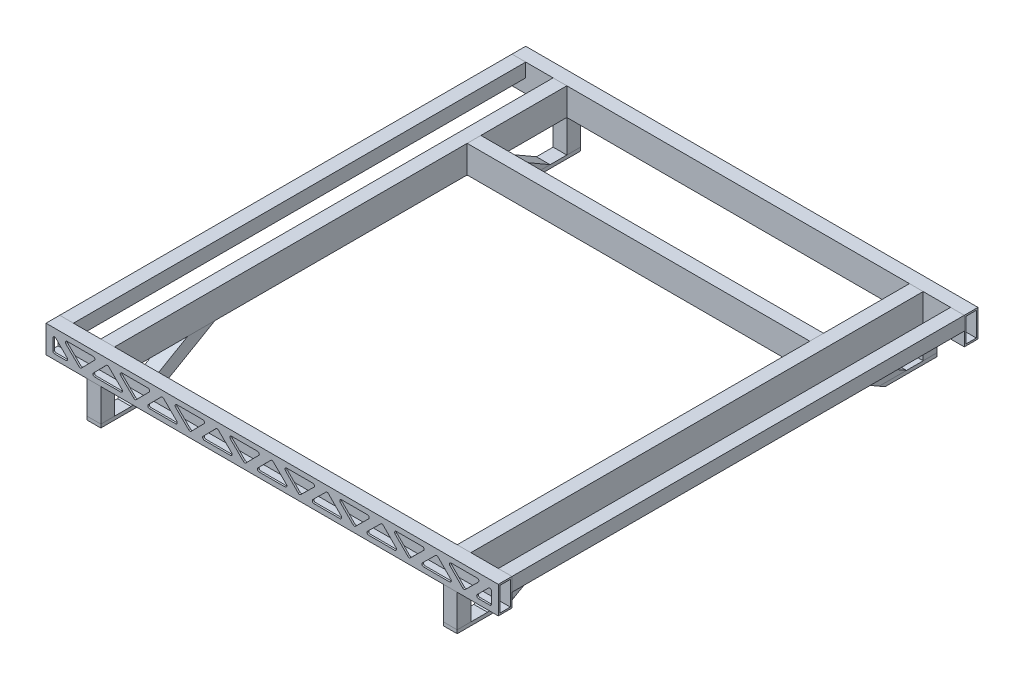
from build123d import *

# Parameters (mm, degrees)
SKETCH12_W                                = 50.8
SKETCH12_H                                = 25.4
SKETCH12_W_2                              = 44.45
SKETCH12_H_2                              = 19.05
RECTANGULAR_TUBE_2_X_1_X_0_125_1_DEPTH    = 812.8
SKETCH12_ON_SEGMENT_2_W                   = 50.8
SKETCH12_ON_SEGMENT_2_H                   = 25.4
SKETCH12_ON_SEGMENT_2_W_2                 = 44.45
SKETCH12_ON_SEGMENT_2_H_2                 = 19.05
RECTANGULAR_TUBE_2_X_1_X_0_125_1_2_DEPTH  = 812.8
SKETCH12_ON_SEGMENT_3_W                   = 50.8
SKETCH12_ON_SEGMENT_3_H                   = 25.4
SKETCH12_ON_SEGMENT_3_W_2                 = 44.45
SKETCH12_ON_SEGMENT_3_H_2                 = 19.05
RECTANGULAR_TUBE_2_X_1_X_0_125_1_3_DEPTH  = 865.6
SKETCH12_ON_SEGMENT_4_W                   = 50.8
SKETCH12_ON_SEGMENT_4_H                   = 25.4
SKETCH12_ON_SEGMENT_4_W_2                 = 44.45
SKETCH12_ON_SEGMENT_4_H_2                 = 19.05
RECTANGULAR_TUBE_2_X_1_X_0_125_1_4_DEPTH  = 865.6
SKETCH15_W                                = 25.4
SKETCH15_H                                = 25.4
SKETCH15_W_2                              = 19.05
SKETCH15_H_2                              = 19.05
RECTANGULAR_TUBE_1_X_1_X_0_125_2_DEPTH    = 863.6
PART_RUN_ON_DEPTH                         = 12.7
BODY_2_RUN_ON_DEPTH                       = 12.7
SKETCH16_W                                = 25.4
SKETCH16_H                                = 25.4
SKETCH16_W_2                              = 19.05
SKETCH16_H_2                              = 19.05
RECTANGULAR_TUBE_1_X_1_X_0_125_3_DEPTH    = 863.6
BODY_START                                = 812.8
BODY_2_RUN_ON_2_DEPTH                     = 12.7
PART_START                                = 812.8
PART_RUN_ON_2_DEPTH                       = 12.7
SKETCH17_W                                = 25.4
SKETCH17_H                                = 25.4
SKETCH17_W_2                              = 19.05
SKETCH17_H_2                              = 19.05
RECTANGULAR_TUBE_1_X_1_X_0_125_4_DEPTH    = 88.9
SKETCH18_W                                = 25.4
SKETCH18_H                                = 25.4
SKETCH18_W_2                              = 19.05
SKETCH18_H_2                              = 19.05
RECTANGULAR_TUBE_1_X_1_X_0_125_5_DEPTH    = 177.8
SKETCH110_W                               = 25.4
SKETCH110_H                               = 6.35
FLAT_STOCK_1_X_0_25_1_DEPTH               = 63.5
BODY_9_RUN_ON_DEPTH                       = 12.7
BODY_START_2                              = 63.5
BODY_9_RUN_ON_2_DEPTH                     = 135.385226
BODY_START_3                              = -1e-09
BODY_8_RUN_ON_DEPTH                       = 95.320529
SKETCH111_W                               = 25.4
SKETCH111_H                               = 25.4
SKETCH111_W_2                             = 19.05
SKETCH111_H_2                             = 19.05
RECTANGULAR_TUBE_1_X_1_X_0_125_14_DEPTH   = 88.9
SKETCH111_ON_SEGMENT_2_W                  = 25.4
SKETCH111_ON_SEGMENT_2_H                  = 25.4
SKETCH111_ON_SEGMENT_2_W_2                = 19.05
SKETCH111_ON_SEGMENT_2_H_2                = 19.05
RECTANGULAR_TUBE_1_X_1_X_0_125_14_2_DEPTH = 88.9
SKETCH111_ON_SEGMENT_3_W                  = 25.4
SKETCH111_ON_SEGMENT_3_H                  = 25.4
SKETCH111_ON_SEGMENT_3_W_2                = 19.05
SKETCH111_ON_SEGMENT_3_H_2                = 19.05
RECTANGULAR_TUBE_1_X_1_X_0_125_14_3_DEPTH = 88.9
SKETCH112_W                               = 25.4
SKETCH112_H                               = 25.4
SKETCH112_W_2                             = 19.05
SKETCH112_H_2                             = 19.05
RECTANGULAR_TUBE_1_X_1_X_0_125_15_DEPTH   = 177.8
SKETCH113_W                               = 25.4
SKETCH113_H                               = 25.4
SKETCH113_W_2                             = 19.05
SKETCH113_H_2                             = 19.05
RECTANGULAR_TUBE_1_X_1_X_0_125_16_DEPTH   = 177.8
SKETCH114_W                               = 25.4
SKETCH114_H                               = 25.4
SKETCH114_W_2                             = 19.05
SKETCH114_H_2                             = 19.05
RECTANGULAR_TUBE_1_X_1_X_0_125_17_DEPTH   = 177.8
SKETCH115_W                               = 25.4
SKETCH115_H                               = 6.35
FLAT_STOCK_1_X_0_25_2_DEPTH               = 63.5
SKETCH115_ON_SEGMENT_2_W                  = 25.4
SKETCH115_ON_SEGMENT_2_H                  = 6.35
FLAT_STOCK_1_X_0_25_2_2_DEPTH             = 63.5
SKETCH115_ON_SEGMENT_3_W                  = 25.4
SKETCH115_ON_SEGMENT_3_H                  = 6.35
FLAT_STOCK_1_X_0_25_2_3_DEPTH             = 63.5
BODY_17_RUN_ON_DEPTH                      = 207.138843
BODY_14_RUN_ON_DEPTH                      = 80.655833
BODY_17_RUN_ON_2_DEPTH                    = 12.7
BODY_16_RUN_ON_DEPTH                      = 12.7
BODY_16_RUN_ON_2_DEPTH                    = 207.138843
BODY_13_RUN_ON_DEPTH                      = 95.320529
BODY_18_RUN_ON_DEPTH                      = 207.138843
BODY_15_RUN_ON_DEPTH                      = 80.655833
BODY_18_RUN_ON_2_DEPTH                    = 12.7
TRIM_EXTEND18_START                       = -25.4
TRIM_EXTEND18_OUTLINE_W                   = 25.4
TRIM_EXTEND18_OUTLINE_H                   = 79
TRIM_EXTEND18_DEPTH                       = 36.398522628
SKETCH1_W                                 = 50.8
SKETCH1_H                                 = 25.4
SKETCH1_W_2                               = 44.45
SKETCH1_H_2                               = 19.05
RECTANGULAR_TUBE_2_X_1_X_0_125_4_DEPTH    = 660.4
CUT_EXTRUDE1_DEPTH                        = 3.175


# Read off the part's stored shape, not the designer's step: Trim/Extend18
with BuildPart() as part:
    # Sketch12 → Rectangular tube 2 X 1 X 0.125(1) (new body)
    with BuildSketch(Plane(origin=(-406.4, 0, -431.8), x_dir=(0, 1, 0), z_dir=(1, 0, 0))):
        Rectangle(SKETCH12_W, SKETCH12_H)
        Rectangle(SKETCH12_W_2, SKETCH12_H_2, mode=Mode.SUBTRACT)
    extrude(amount=RECTANGULAR_TUBE_2_X_1_X_0_125_1_DEPTH)

    # Sketch12 → part run on (add)
    with BuildSketch(Plane(origin=(-406.4, 0, -431.8), x_dir=(0, 1, 0), z_dir=(1, 0, 0))):
        Rectangle(SKETCH12_W, SKETCH12_H)
        Rectangle(SKETCH12_W_2, SKETCH12_H_2, mode=Mode.SUBTRACT)
    extrude(amount=-PART_RUN_ON_DEPTH)

    # Sketch12 → part run on 2 (add)
    with BuildSketch(Plane(origin=(-406.4, 0, -431.8), x_dir=(0, 1, 0), z_dir=(1, 0, 0)).offset(PART_START)):
        Rectangle(SKETCH12_W, SKETCH12_H)
        Rectangle(SKETCH12_W_2, SKETCH12_H_2, mode=Mode.SUBTRACT)
    extrude(amount=PART_RUN_ON_2_DEPTH)


with BuildPart() as body_2:
    # Sketch12 on segment 2 (carried to segment 2) → Rectangular tube 2 X 1 X 0.125_1 2 (new body)
    with BuildSketch(Plane(origin=(-406.4, 0, 431.8), x_dir=(0, 1, 0), z_dir=(1, 0, 0))):
        Rectangle(SKETCH12_ON_SEGMENT_2_W, SKETCH12_ON_SEGMENT_2_H)
        Rectangle(SKETCH12_ON_SEGMENT_2_W_2, SKETCH12_ON_SEGMENT_2_H_2, mode=Mode.SUBTRACT)
    extrude(amount=RECTANGULAR_TUBE_2_X_1_X_0_125_1_2_DEPTH)

    # Sketch12 on segment 2 (carried to segment 2) → body 2 run on (add)
    with BuildSketch(Plane(origin=(-406.4, 0, 431.8), x_dir=(0, 1, 0), z_dir=(1, 0, 0))):
        Rectangle(SKETCH12_ON_SEGMENT_2_W, SKETCH12_ON_SEGMENT_2_H)
        Rectangle(SKETCH12_ON_SEGMENT_2_W_2, SKETCH12_ON_SEGMENT_2_H_2, mode=Mode.SUBTRACT)
    extrude(amount=-BODY_2_RUN_ON_DEPTH)

    # Sketch12 on segment 2 (carried to segment 2) → body 2 run on 2 (add)
    with BuildSketch(Plane(origin=(-406.4, 0, 431.8), x_dir=(0, 1, 0), z_dir=(1, 0, 0)).offset(BODY_START)):
        Rectangle(SKETCH12_ON_SEGMENT_2_W, SKETCH12_ON_SEGMENT_2_H)
        Rectangle(SKETCH12_ON_SEGMENT_2_W_2, SKETCH12_ON_SEGMENT_2_H_2, mode=Mode.SUBTRACT)
    extrude(amount=BODY_2_RUN_ON_2_DEPTH)

    # Sketch116 → Cut-Extrude1 (cut)
    with BuildSketch(Plane.XY.offset(444.5)):
        with BuildLine():
            Line((-406.4, 8.209871939), (-406.4, -12.7))
            ThreePointArc((-406.4, -12.7), (-405.47006403, -14.94506403), (-403.225, -15.875))
            Line((-403.225, -15.875), (-382.315128061, -15.875))
            ThreePointArc((-382.315128061, -15.875), (-379.381810545, -13.915019898), (-380.07006403, -10.45493597))
            Line((-380.07006403, -10.45493597), (-400.97993597, 10.45493597))
            ThreePointArc((-400.97993597, 10.45493597), (-404.440019898, 11.143189455), (-406.4, 8.209871939))
        make_face()
        with BuildLine():
            Line((403.225, -15.875), (382.315128061, -15.875))
            ThreePointArc((382.315128061, -15.875), (379.381810545, -13.915019898), (380.07006403, -10.45493597))
            Line((380.07006403, -10.45493597), (400.97993597, 10.45493597))
            ThreePointArc((400.97993597, 10.45493597), (404.440019898, 11.143189455), (406.4, 8.209871939))
            Line((406.4, 8.209871939), (406.4, -12.7))
            ThreePointArc((406.4, -12.7), (405.47006403, -14.94506403), (403.225, -15.875))
        make_face()
        with BuildLine():
            Line((-331.123393313, -10.470866156), (-307.376619293, 13.614118024))
            ThreePointArc((-307.376619293, 13.614118024), (-305.138186637, 14.559904814), (-302.886603474, 13.645866156))
            Line((-302.886603474, 13.645866156), (-278.458592221, -10.439118024))
            ThreePointArc((-278.458592221, -10.439118024), (-277.750131362, -13.904642006), (-280.687726064, -15.875))
            Line((-280.687726064, -15.875), (-328.862511338, -15.875))
            ThreePointArc((-328.862511338, -15.875), (-331.791515004, -13.925382603), (-331.123393313, -10.470866156))
        make_face()
        with BuildLine():
            Line((-329.518410641, 10.470866156), (-353.265184661, -13.614118024))
            ThreePointArc((-353.265184661, -13.614118024), (-355.503617317, -14.559904814), (-357.75520048, -13.645866156))
            Line((-357.75520048, -13.645866156), (-382.183211734, 10.439118024))
            ThreePointArc((-382.183211734, 10.439118024), (-382.891672593, 13.904642006), (-379.95407789, 15.875))
            Line((-379.95407789, 15.875), (-331.779292617, 15.875))
            ThreePointArc((-331.779292617, 15.875), (-328.850288951, 13.925382603), (-329.518410641, 10.470866156))
        make_face()
        with BuildLine():
            Line((-227.926704408, 10.470866156), (-251.673478428, -13.614118024))
            ThreePointArc((-251.673478428, -13.614118024), (-253.911911084, -14.559904814), (-256.163494247, -13.645866156))
            Line((-256.163494247, -13.645866156), (-280.5915055, 10.439118024))
            ThreePointArc((-280.5915055, 10.439118024), (-281.299966359, 13.904642006), (-278.362371657, 15.875))
            Line((-278.362371657, 15.875), (-230.187586383, 15.875))
            ThreePointArc((-230.187586383, 15.875), (-227.258582717, 13.925382603), (-227.926704408, 10.470866156))
        make_face()
        with BuildLine():
            Line((-126.334998174, 10.470866156), (-150.081772194, -13.614118024))
            ThreePointArc((-150.081772194, -13.614118024), (-152.32020485, -14.559904814), (-154.571788013, -13.645866156))
            Line((-154.571788013, -13.645866156), (-178.999799267, 10.439118024))
            ThreePointArc((-178.999799267, 10.439118024), (-179.708260125, 13.904642006), (-176.770665423, 15.875))
            Line((-176.770665423, 15.875), (-128.59588015, 15.875))
            ThreePointArc((-128.59588015, 15.875), (-125.666876483, 13.925382603), (-126.334998174, 10.470866156))
        make_face()
        with BuildLine():
            Line((-24.74329194, 10.470866156), (-48.49006596, -13.614118024))
            ThreePointArc((-48.49006596, -13.614118024), (-50.728498616, -14.559904814), (-52.980081779, -13.645866156))
            Line((-52.980081779, -13.645866156), (-77.408093033, 10.439118024))
            ThreePointArc((-77.408093033, 10.439118024), (-78.116553892, 13.904642006), (-75.178959189, 15.875))
            Line((-75.178959189, 15.875), (-27.004173916, 15.875))
            ThreePointArc((-27.004173916, 15.875), (-24.07517025, 13.925382603), (-24.74329194, 10.470866156))
        make_face()
        with BuildLine():
            Line((-229.53168708, -10.470866156), (-205.78491306, 13.614118024))
            ThreePointArc((-205.78491306, 13.614118024), (-203.546480403, 14.559904814), (-201.29489724, 13.645866156))
            Line((-201.29489724, 13.645866156), (-176.866885987, -10.439118024))
            ThreePointArc((-176.866885987, -10.439118024), (-176.158425128, -13.904642006), (-179.096019831, -15.875))
            Line((-179.096019831, -15.875), (-227.270805104, -15.875))
            ThreePointArc((-227.270805104, -15.875), (-230.19980877, -13.925382603), (-229.53168708, -10.470866156))
        make_face()
        with BuildLine():
            Line((-127.939980846, -10.470866156), (-104.193206826, 13.614118024))
            ThreePointArc((-104.193206826, 13.614118024), (-101.95477417, 14.559904814), (-99.703191007, 13.645866156))
            Line((-99.703191007, 13.645866156), (-75.275179753, -10.439118024))
            ThreePointArc((-75.275179753, -10.439118024), (-74.566718894, -13.904642006), (-77.504313597, -15.875))
            Line((-77.504313597, -15.875), (-125.67909887, -15.875))
            ThreePointArc((-125.67909887, -15.875), (-128.608102537, -13.925382603), (-127.939980846, -10.470866156))
        make_face()
        with BuildLine():
            Line((-26.348274612, -10.470866156), (-2.601500592, 13.614118024))
            ThreePointArc((-2.601500592, 13.614118024), (-0.363067936, 14.559904814), (1.888515227, 13.645866156))
            Line((1.888515227, 13.645866156), (26.31652648, -10.439118024))
            ThreePointArc((26.31652648, -10.439118024), (27.024987339, -13.904642006), (24.087392637, -15.875))
            Line((24.087392637, -15.875), (-24.087392637, -15.875))
            ThreePointArc((-24.087392637, -15.875), (-27.016396303, -13.925382603), (-26.348274612, -10.470866156))
        make_face()
        with BuildLine():
            Line((229.53168708, -10.470866156), (205.78491306, 13.614118024))
            ThreePointArc((205.78491306, 13.614118024), (203.546480403, 14.559904814), (201.29489724, 13.645866156))
            Line((201.29489724, 13.645866156), (176.866885987, -10.439118024))
            ThreePointArc((176.866885987, -10.439118024), (176.158425128, -13.904642006), (179.096019831, -15.875))
            Line((179.096019831, -15.875), (227.270805104, -15.875))
            ThreePointArc((227.270805104, -15.875), (230.19980877, -13.925382603), (229.53168708, -10.470866156))
        make_face()
        with BuildLine():
            Line((127.939980846, -10.470866156), (104.193206826, 13.614118024))
            ThreePointArc((104.193206826, 13.614118024), (101.95477417, 14.559904814), (99.703191007, 13.645866156))
            Line((99.703191007, 13.645866156), (75.275179753, -10.439118024))
            ThreePointArc((75.275179753, -10.439118024), (74.566718894, -13.904642006), (77.504313597, -15.875))
            Line((77.504313597, -15.875), (125.67909887, -15.875))
            ThreePointArc((125.67909887, -15.875), (128.608102537, -13.925382603), (127.939980846, -10.470866156))
        make_face()
        with BuildLine():
            Line((227.926704408, 10.470866156), (251.673478428, -13.614118024))
            ThreePointArc((251.673478428, -13.614118024), (253.911911084, -14.559904814), (256.163494247, -13.645866156))
            Line((256.163494247, -13.645866156), (280.5915055, 10.439118024))
            ThreePointArc((280.5915055, 10.439118024), (281.299966359, 13.904642006), (278.362371657, 15.875))
            Line((278.362371657, 15.875), (230.187586383, 15.875))
            ThreePointArc((230.187586383, 15.875), (227.258582717, 13.925382603), (227.926704408, 10.470866156))
        make_face()
        with BuildLine():
            Line((126.334998174, 10.470866156), (150.081772194, -13.614118024))
            ThreePointArc((150.081772194, -13.614118024), (152.32020485, -14.559904814), (154.571788013, -13.645866156))
            Line((154.571788013, -13.645866156), (178.999799267, 10.439118024))
            ThreePointArc((178.999799267, 10.439118024), (179.708260125, 13.904642006), (176.770665423, 15.875))
            Line((176.770665423, 15.875), (128.59588015, 15.875))
            ThreePointArc((128.59588015, 15.875), (125.666876483, 13.925382603), (126.334998174, 10.470866156))
        make_face()
        with BuildLine():
            Line((24.74329194, 10.470866156), (48.49006596, -13.614118024))
            ThreePointArc((48.49006596, -13.614118024), (50.728498616, -14.559904814), (52.980081779, -13.645866156))
            Line((52.980081779, -13.645866156), (77.408093033, 10.439118024))
            ThreePointArc((77.408093033, 10.439118024), (78.116553892, 13.904642006), (75.178959189, 15.875))
            Line((75.178959189, 15.875), (27.004173916, 15.875))
            ThreePointArc((27.004173916, 15.875), (24.07517025, 13.925382603), (24.74329194, 10.470866156))
        make_face()
        with BuildLine():
            Line((329.518410641, 10.470866156), (353.265184661, -13.614118024))
            ThreePointArc((353.265184661, -13.614118024), (355.503617317, -14.559904814), (357.75520048, -13.645866156))
            Line((357.75520048, -13.645866156), (382.183211734, 10.439118024))
            ThreePointArc((382.183211734, 10.439118024), (382.891672593, 13.904642006), (379.95407789, 15.875))
            Line((379.95407789, 15.875), (331.779292617, 15.875))
            ThreePointArc((331.779292617, 15.875), (328.850288951, 13.925382603), (329.518410641, 10.470866156))
        make_face()
        with BuildLine():
            Line((331.123393313, -10.470866156), (307.376619293, 13.614118024))
            ThreePointArc((307.376619293, 13.614118024), (305.138186637, 14.559904814), (302.886603474, 13.645866156))
            Line((302.886603474, 13.645866156), (278.458592221, -10.439118024))
            ThreePointArc((278.458592221, -10.439118024), (277.750131362, -13.904642006), (280.687726064, -15.875))
            Line((280.687726064, -15.875), (328.862511338, -15.875))
            ThreePointArc((328.862511338, -15.875), (331.791515004, -13.925382603), (331.123393313, -10.470866156))
        make_face()
    extrude(amount=-CUT_EXTRUDE1_DEPTH, mode=Mode.SUBTRACT)


with BuildPart() as body_3:
    # Sketch12 on segment 3 (carried to segment 3) → Rectangular tube 2 X 1 X 0.125_1 3 (new body)
    with BuildSketch(Plane(origin=(-330.2, 0, -432.8), x_dir=(0, 1, 0), z_dir=(0, 0, 1))):
        Rectangle(SKETCH12_ON_SEGMENT_3_W, SKETCH12_ON_SEGMENT_3_H)
        Rectangle(SKETCH12_ON_SEGMENT_3_W_2, SKETCH12_ON_SEGMENT_3_H_2, mode=Mode.SUBTRACT)
    extrude(amount=RECTANGULAR_TUBE_2_X_1_X_0_125_1_3_DEPTH)

    # Rectangular tube 2 X 1 X 0.125_1 3 end b
    split(bisect_by=Plane(origin=(-330.2, 0, -419.1), x_dir=(0, -1, 0), z_dir=(0, 0, 1)), keep=Keep.TOP)

    # Rectangular tube 2 X 1 X 0.125_1 3 e 2
    split(bisect_by=Plane(origin=(-330.2, 0, 419.1), x_dir=(0, 1, 0), z_dir=(0, 0, -1)), keep=Keep.TOP)


with BuildPart() as body_4:
    # Sketch12 on segment 4 (carried to segment 4) → Rectangular tube 2 X 1 X 0.125_1 4 (new body)
    with BuildSketch(Plane(origin=(330.2, 0, -432.8), x_dir=(0, 1, 0), z_dir=(0, 0, 1))):
        Rectangle(SKETCH12_ON_SEGMENT_4_W, SKETCH12_ON_SEGMENT_4_H)
        Rectangle(SKETCH12_ON_SEGMENT_4_W_2, SKETCH12_ON_SEGMENT_4_H_2, mode=Mode.SUBTRACT)
    extrude(amount=RECTANGULAR_TUBE_2_X_1_X_0_125_1_4_DEPTH)

    # Rectangular tube 2 X 1 X 0.125_1 4 end b
    split(bisect_by=Plane(origin=(330.2, 0, -419.1), x_dir=(0, -1, 0), z_dir=(0, 0, 1)), keep=Keep.TOP)

    # Rectangular tube 2 X 1 X 0.125_1 4 e 2
    split(bisect_by=Plane(origin=(330.2, 0, 419.1), x_dir=(0, 1, 0), z_dir=(0, 0, -1)), keep=Keep.TOP)


with BuildPart() as body_5:
    # Sketch15 → Rectangular tube 1 X 1 X 0.125(2) (new body)
    with BuildSketch(Plane(origin=(-406.4, 12.7, -431.8), x_dir=(1, 0, 0), z_dir=(0, 0, 1))):
        Rectangle(SKETCH15_W, SKETCH15_H)
        Rectangle(SKETCH15_W_2, SKETCH15_H_2, mode=Mode.SUBTRACT)
    extrude(amount=RECTANGULAR_TUBE_1_X_1_X_0_125_2_DEPTH)

    # Trim_Extend4 3
    split(bisect_by=Plane(origin=(0, 0, -419.1), x_dir=(0, -1, 0), z_dir=(0, 0, 1)), keep=Keep.TOP)

    # Trim/Extend5
    split(bisect_by=Plane.YX.offset(-419.1), keep=Keep.TOP)


with BuildPart() as body_6:
    # Sketch16 → Rectangular tube 1 X 1 X 0.125(3) (new body)
    with BuildSketch(Plane(origin=(406.4, 12.7, -431.8), x_dir=(1, 0, 0), z_dir=(0, 0, 1))):
        Rectangle(SKETCH16_W, SKETCH16_H)
        Rectangle(SKETCH16_W_2, SKETCH16_H_2, mode=Mode.SUBTRACT)
    extrude(amount=RECTANGULAR_TUBE_1_X_1_X_0_125_3_DEPTH)

    # Trim/Extend6
    split(bisect_by=Plane(origin=(-6.35, 0, 419.1), x_dir=(0, 1, 0), z_dir=(0, 0, -1)), keep=Keep.TOP)

    # Trim_Extend7 3
    split(bisect_by=Plane(origin=(-6.35, 0, -419.1), x_dir=(0, -1, 0), z_dir=(0, 0, 1)), keep=Keep.TOP)


with BuildPart() as body_7:
    # Sketch17 → Rectangular tube 1 X 1 X 0.125(4) (new body)
    with BuildSketch(Plane(origin=(330.2, 0, 431.8), x_dir=(1, 0, 0), z_dir=(0, -1, 0))):
        Rectangle(SKETCH17_W, SKETCH17_H)
        Rectangle(SKETCH17_W_2, SKETCH17_H_2, mode=Mode.SUBTRACT)
    extrude(amount=RECTANGULAR_TUBE_1_X_1_X_0_125_4_DEPTH)

    # Trim_Extend8 11
    split(bisect_by=Plane(origin=(0, -25.4, 431.8), x_dir=(1, 0, 0), z_dir=(0, -1, 0)), keep=Keep.TOP)

    # Trim/Extend10
    split(bisect_by=Plane(origin=(330.2, -85.725, 400.05), x_dir=(-1, 0, 0), z_dir=(0, 1, 0)), keep=Keep.TOP)


with BuildPart() as body_8:
    # Sketch18 → Rectangular tube 1 X 1 X 0.125(5) (new body)
    with BuildSketch(Plane(origin=(330.2, -88.9, 368.3), x_dir=(1, 0, 0), z_dir=(0, 0.49999999999999534, -0.8660254037844414))):
        Rectangle(SKETCH18_W, SKETCH18_H)
        Rectangle(SKETCH18_W_2, SKETCH18_H_2, mode=Mode.SUBTRACT)
    extrude(amount=RECTANGULAR_TUBE_1_X_1_X_0_125_5_DEPTH)

    # Trim/Extend9
    split(bisect_by=Plane(origin=(330.2, -25.4, 0), x_dir=(1, 0, 0), z_dir=(0, -1, 0)), keep=Keep.TOP)

    # Sketch18 → body 8 run on (add)
    with BuildSketch(Plane(origin=(330.2, -88.9, 368.3), x_dir=(1, 0, 0), z_dir=(0, 0.49999999999999534, -0.8660254037844414)).offset(BODY_START_3)):
        Rectangle(SKETCH18_W, SKETCH18_H)
        Rectangle(SKETCH18_W_2, SKETCH18_H_2, mode=Mode.SUBTRACT)
    extrude(amount=-BODY_8_RUN_ON_DEPTH)

    # Trim/Extend11
    split(bisect_by=Plane(origin=(330.2, -85.725, 406.4), x_dir=(-1, 0, 0), z_dir=(0, 1, 0)), keep=Keep.TOP)


with BuildPart() as body_9:
    # Sketch110 → Flat stock 1 X 0.25(1) (new body)
    with BuildSketch(Plane(origin=(330.2, -88.9, 431.8), x_dir=(1, 0, 0), z_dir=(0, 0, -1))):
        Rectangle(SKETCH110_W, SKETCH110_H)
    extrude(amount=FLAT_STOCK_1_X_0_25_1_DEPTH)

    # Sketch110 → body 9 run on (add)
    with BuildSketch(Plane(origin=(330.2, -88.9, 431.8), x_dir=(1, 0, 0), z_dir=(0, 0, -1))):
        Rectangle(SKETCH110_W, SKETCH110_H)
    extrude(amount=-BODY_9_RUN_ON_DEPTH)

    # Sketch110 → body 9 run on 2 (add)
    with BuildSketch(Plane(origin=(330.2, -88.9, 431.8), x_dir=(1, 0, 0), z_dir=(0, 0, -1)).offset(BODY_START_2)):
        Rectangle(SKETCH110_W, SKETCH110_H)
    extrude(amount=BODY_9_RUN_ON_2_DEPTH)

    # Trim_Extend11 2
    split(bisect_by=Plane(origin=(330.2, -62.649261314, 297.43238686), x_dir=(-1, 0, 0), z_dir=(0, 0.866025404, 0.5)), keep=Keep.TOP)


with BuildPart() as body_10:
    # Sketch111 → Rectangular tube 1 X 1 X 0.125(14) (new body)
    with BuildSketch(Plane(origin=(-330.2, 0, 431.8), x_dir=(1, 0, 0), z_dir=(0, -1, 0))):
        Rectangle(SKETCH111_W, SKETCH111_H)
        Rectangle(SKETCH111_W_2, SKETCH111_H_2, mode=Mode.SUBTRACT)
    extrude(amount=RECTANGULAR_TUBE_1_X_1_X_0_125_14_DEPTH)

    # Trim/Extend14
    split(bisect_by=Plane(origin=(-330.2, -85.725, 400.05), x_dir=(-1, 0, 0), z_dir=(0, 1, 0)), keep=Keep.TOP)

    # Trim/Extend22
    split(bisect_by=Plane(origin=(0, -25.4, 431.8), x_dir=(1, 0, 0), z_dir=(0, -1, 0)), keep=Keep.TOP)


with BuildPart() as body_11:
    # Sketch111 on segment 2 (carried to segment 2) → Rectangular tube 1 X 1 X 0.125_14 2 (new body)
    with BuildSketch(Plane(origin=(-330.2, 0, -431.8), x_dir=(1, 0, 0), z_dir=(0, -1, 0))):
        Rectangle(SKETCH111_ON_SEGMENT_2_W, SKETCH111_ON_SEGMENT_2_H)
        Rectangle(SKETCH111_ON_SEGMENT_2_W_2, SKETCH111_ON_SEGMENT_2_H_2, mode=Mode.SUBTRACT)
    extrude(amount=RECTANGULAR_TUBE_1_X_1_X_0_125_14_2_DEPTH)

    # Trim/Extend17
    split(bisect_by=Plane(origin=(-330.2, -85.725, -384.60036935), x_dir=(-1, 0, 0), z_dir=(0, 1, 0)), keep=Keep.TOP)

    # Trim/Extend20
    split(bisect_by=Plane(origin=(-330.2, -25.4, 0), x_dir=(1, 0, 0), z_dir=(0, -1, 0)), keep=Keep.TOP)


with BuildPart() as body_12:
    # Sketch111 on segment 3 (carried to segment 3) → Rectangular tube 1 X 1 X 0.125_14 3 (new body)
    with BuildSketch(Plane(origin=(330.2, 0, -431.8), x_dir=(1, 0, 0), z_dir=(0, -1, 0))):
        Rectangle(SKETCH111_ON_SEGMENT_3_W, SKETCH111_ON_SEGMENT_3_H)
        Rectangle(SKETCH111_ON_SEGMENT_3_W_2, SKETCH111_ON_SEGMENT_3_H_2, mode=Mode.SUBTRACT)
    extrude(amount=RECTANGULAR_TUBE_1_X_1_X_0_125_14_3_DEPTH)

    # Trim/Extend13
    split(bisect_by=Plane(origin=(330.2, -85.725, -384.60036935), x_dir=(-1, 0, 0), z_dir=(0, 1, 0)), keep=Keep.TOP)

    # Trim/Extend19
    split(bisect_by=Plane(origin=(0, -25.4, -431.8), x_dir=(1, 0, 0), z_dir=(0, -1, 0)), keep=Keep.TOP)


with BuildPart() as body_13:
    # Sketch112 → Rectangular tube 1 X 1 X 0.125(15) (new body)
    with BuildSketch(Plane(origin=(-330.2, -88.9, 368.3), x_dir=(1, 0, 0), z_dir=(0, 0.49999999999999534, -0.8660254037844414))):
        Rectangle(SKETCH112_W, SKETCH112_H)
        Rectangle(SKETCH112_W_2, SKETCH112_H_2, mode=Mode.SUBTRACT)
    extrude(amount=RECTANGULAR_TUBE_1_X_1_X_0_125_15_DEPTH)

    # Sketch112 → body 13 run on (add)
    with BuildSketch(Plane(origin=(-330.2, -88.9, 368.3), x_dir=(1, 0, 0), z_dir=(0, 0.49999999999999534, -0.8660254037844414)).offset(BODY_START_3)):
        Rectangle(SKETCH112_W, SKETCH112_H)
        Rectangle(SKETCH112_W_2, SKETCH112_H_2, mode=Mode.SUBTRACT)
    extrude(amount=-BODY_13_RUN_ON_DEPTH)

    # Trim/Extend15
    split(bisect_by=Plane(origin=(-330.2, -85.725, 406.4), x_dir=(-1, 0, 0), z_dir=(0, 1, 0)), keep=Keep.TOP)

    # Trim/Extend21
    split(bisect_by=Plane(origin=(-330.2, -25.4, 0), x_dir=(1, 0, 0), z_dir=(0, -1, 0)), keep=Keep.TOP)


with BuildPart() as body_14:
    # Sketch113 → Rectangular tube 1 X 1 X 0.125(16) (new body)
    with BuildSketch(Plane(origin=(330.2, -88.9, -368.3), x_dir=(1, 0, 0), z_dir=(0, 0.4999999999999952, 0.8660254037844414))):
        Rectangle(SKETCH113_W, SKETCH113_H)
        Rectangle(SKETCH113_W_2, SKETCH113_H_2, mode=Mode.SUBTRACT)
    extrude(amount=RECTANGULAR_TUBE_1_X_1_X_0_125_16_DEPTH)

    # Sketch113 → body 14 run on (add)
    with BuildSketch(Plane(origin=(330.2, -88.9, -368.3), x_dir=(1, 0, 0), z_dir=(0, 0.4999999999999952, 0.8660254037844414)).offset(BODY_START_3)):
        Rectangle(SKETCH113_W, SKETCH113_H)
        Rectangle(SKETCH113_W_2, SKETCH113_H_2, mode=Mode.SUBTRACT)
    extrude(amount=-BODY_14_RUN_ON_DEPTH)

    # Trim/Extend12
    split(bisect_by=Plane(origin=(330.2, -85.725, -400.05), x_dir=(-1, 0, 0), z_dir=(0, 1, 0)), keep=Keep.TOP)

    # Trim/Extend18 outline → Trim/Extend18 (cut)
    with BuildSketch(Plane(origin=(0, 0, 0), x_dir=(1, 0, 0), z_dir=(0, 1, 0)).offset(TRIM_EXTEND18_START)):
        with Locations((330.2, 245.5)):
            Rectangle(TRIM_EXTEND18_OUTLINE_W, TRIM_EXTEND18_OUTLINE_H)
    extrude(amount=TRIM_EXTEND18_DEPTH, mode=Mode.SUBTRACT)


with BuildPart() as body_15:
    # Sketch114 → Rectangular tube 1 X 1 X 0.125(17) (new body)
    with BuildSketch(Plane(origin=(-330.2, -88.9, -368.3), x_dir=(1, 0, 0), z_dir=(0, 0.4999999999999952, 0.8660254037844414))):
        Rectangle(SKETCH114_W, SKETCH114_H)
        Rectangle(SKETCH114_W_2, SKETCH114_H_2, mode=Mode.SUBTRACT)
    extrude(amount=RECTANGULAR_TUBE_1_X_1_X_0_125_17_DEPTH)

    # Sketch114 → body 15 run on (add)
    with BuildSketch(Plane(origin=(-330.2, -88.9, -368.3), x_dir=(1, 0, 0), z_dir=(0, 0.4999999999999952, 0.8660254037844414)).offset(BODY_START_3)):
        Rectangle(SKETCH114_W, SKETCH114_H)
        Rectangle(SKETCH114_W_2, SKETCH114_H_2, mode=Mode.SUBTRACT)
    extrude(amount=-BODY_15_RUN_ON_DEPTH)

    # Trim/Extend16
    split(bisect_by=Plane(origin=(-330.2, -85.725, -400.05), x_dir=(-1, 0, 0), z_dir=(0, 1, 0)), keep=Keep.TOP)

    # Trim/Extend20
    split(bisect_by=Plane(origin=(-330.2, -25.4, 0), x_dir=(1, 0, 0), z_dir=(0, -1, 0)), keep=Keep.TOP)


with BuildPart() as body_16:
    # Sketch115 → Flat stock 1 X 0.25(2) (new body)
    with BuildSketch(Plane(origin=(-330.2, -88.9, 431.8), x_dir=(1, 0, 0), z_dir=(0, 0, -1))):
        Rectangle(SKETCH115_W, SKETCH115_H)
    extrude(amount=FLAT_STOCK_1_X_0_25_2_DEPTH)

    # Sketch115 → body 16 run on (add)
    with BuildSketch(Plane(origin=(-330.2, -88.9, 431.8), x_dir=(1, 0, 0), z_dir=(0, 0, -1))):
        Rectangle(SKETCH115_W, SKETCH115_H)
    extrude(amount=-BODY_16_RUN_ON_DEPTH)

    # Sketch115 → body 16 run on 2 (add)
    with BuildSketch(Plane(origin=(-330.2, -88.9, 431.8), x_dir=(1, 0, 0), z_dir=(0, 0, -1)).offset(BODY_START_2)):
        Rectangle(SKETCH115_W, SKETCH115_H)
    extrude(amount=BODY_16_RUN_ON_2_DEPTH)

    # Trim_Extend15 2
    split(bisect_by=Plane(origin=(-330.2, -55.448522628, 284.960341604), x_dir=(-1, 0, 0), z_dir=(0, 0.866025404, 0.5)), keep=Keep.TOP)


with BuildPart() as body_17:
    # Sketch115 on segment 2 (carried to segment 2) → Flat stock 1 X 0.25_2 2 (new body)
    with BuildSketch(Plane(origin=(330.2, -88.9, -368.3), x_dir=(1, 0, 0), z_dir=(0, 0, -1))):
        Rectangle(SKETCH115_ON_SEGMENT_2_W, SKETCH115_ON_SEGMENT_2_H)
    extrude(amount=FLAT_STOCK_1_X_0_25_2_2_DEPTH)

    # Sketch115 on segment 2 (carried to segment 2) → body 17 run on (add)
    with BuildSketch(Plane(origin=(330.2, -88.9, -368.3), x_dir=(1, 0, 0), z_dir=(0, 0, -1))):
        Rectangle(SKETCH115_ON_SEGMENT_2_W, SKETCH115_ON_SEGMENT_2_H)
    extrude(amount=-BODY_17_RUN_ON_DEPTH)

    # Trim_Extend12 6
    split(bisect_by=Plane(origin=(330.2, -55.448522628, -284.960341604), x_dir=(-1, 0, 0), z_dir=(0, 0.866025404, -0.5)), keep=Keep.TOP)

    # Sketch115 on segment 2 (carried to segment 2) → body 17 run on 2 (add)
    with BuildSketch(Plane(origin=(330.2, -88.9, -368.3), x_dir=(1, 0, 0), z_dir=(0, 0, -1)).offset(BODY_START_2)):
        Rectangle(SKETCH115_ON_SEGMENT_2_W, SKETCH115_ON_SEGMENT_2_H)
    extrude(amount=BODY_17_RUN_ON_2_DEPTH)


with BuildPart() as body_18:
    # Sketch115 on segment 3 (carried to segment 3) → Flat stock 1 X 0.25_2 3 (new body)
    with BuildSketch(Plane(origin=(-330.2, -88.9, -368.3), x_dir=(1, 0, 0), z_dir=(0, 0, -1))):
        Rectangle(SKETCH115_ON_SEGMENT_3_W, SKETCH115_ON_SEGMENT_3_H)
    extrude(amount=FLAT_STOCK_1_X_0_25_2_3_DEPTH)

    # Sketch115 on segment 3 (carried to segment 3) → body 18 run on (add)
    with BuildSketch(Plane(origin=(-330.2, -88.9, -368.3), x_dir=(1, 0, 0), z_dir=(0, 0, -1))):
        Rectangle(SKETCH115_ON_SEGMENT_3_W, SKETCH115_ON_SEGMENT_3_H)
    extrude(amount=-BODY_18_RUN_ON_DEPTH)

    # Trim_Extend16 6
    split(bisect_by=Plane(origin=(-330.2, -55.448522628, -284.960341604), x_dir=(-1, 0, 0), z_dir=(0, 0.866025404, -0.5)), keep=Keep.TOP)

    # Sketch115 on segment 3 (carried to segment 3) → body 18 run on 2 (add)
    with BuildSketch(Plane(origin=(-330.2, -88.9, -368.3), x_dir=(1, 0, 0), z_dir=(0, 0, -1)).offset(BODY_START_2)):
        Rectangle(SKETCH115_ON_SEGMENT_3_W, SKETCH115_ON_SEGMENT_3_H)
    extrude(amount=BODY_18_RUN_ON_2_DEPTH)


with BuildPart() as body_19:
    # Sketch1 → Rectangular tube 2 X 1 X 0.125(4) (new body)
    with BuildSketch(Plane(origin=(-330.2, 0, -247.1055722), x_dir=(0, 1, 0), z_dir=(1, 0, 0))):
        Rectangle(SKETCH1_W, SKETCH1_H)
        Rectangle(SKETCH1_W_2, SKETCH1_H_2, mode=Mode.SUBTRACT)
    extrude(amount=RECTANGULAR_TUBE_2_X_1_X_0_125_4_DEPTH)

    # Trim/Extend23
    split(bisect_by=Plane.YZ.offset(-317.5), keep=Keep.TOP)

    # Trim_Extend23 3
    split(bisect_by=Plane(origin=(317.5, 0, 0), x_dir=(0, -1, 0), z_dir=(-1, 0, 0)), keep=Keep.TOP)


solid = Compound([part.part, body_2.part, body_3.part, body_4.part, body_5.part, body_6.part, body_7.part, body_8.part, body_9.part, body_10.part, body_11.part, body_12.part, body_13.part, body_14.part, body_15.part, body_16.part, body_17.part, body_18.part, body_19.part])
